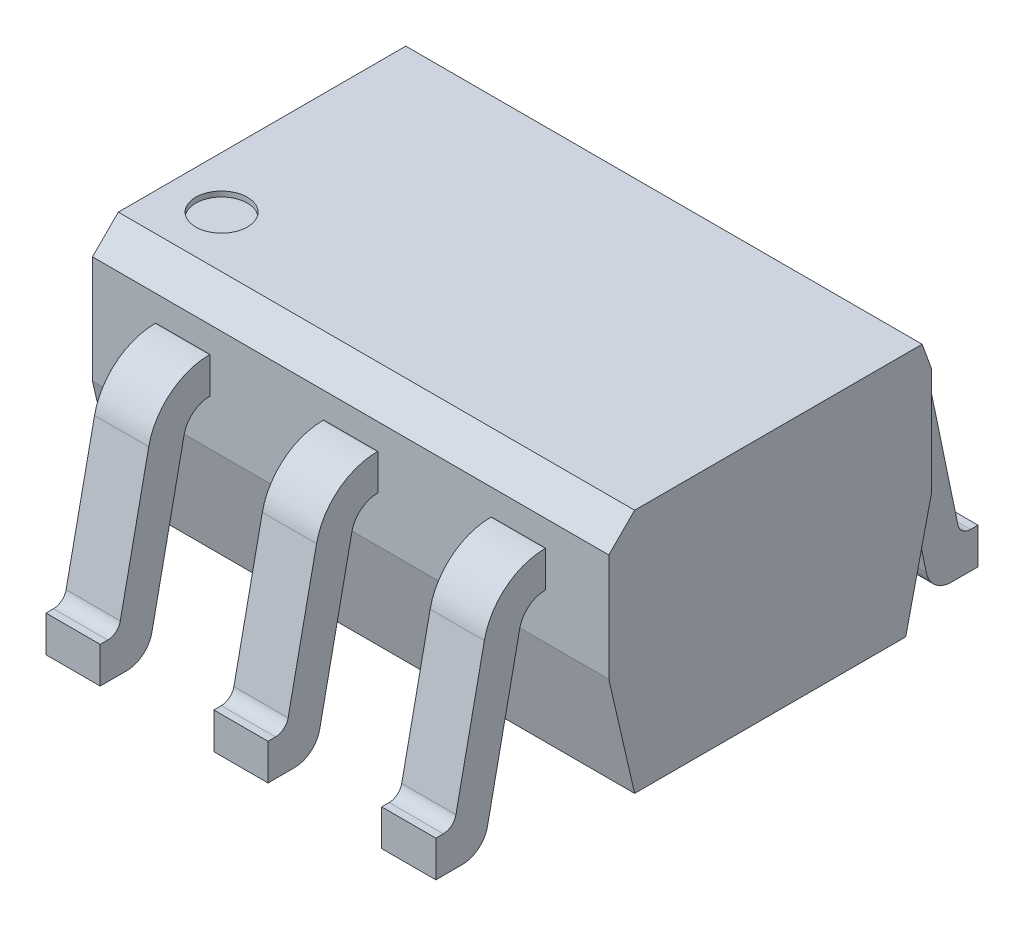
from build123d import *

# Parameters (mm, degrees)
SKETCH_2_W                     = 2
SKETCH_2_H                     = 1.25
EXTRUDE_1_DEPTH                = 0.95
EXTRUDE_2_DEPTH                = 0.105
FILLET_1_R                     = 0.05
CHAMFER_1_SIZE                 = 0.1
PATTERN_LINEAR_2_COUNT         = 3
PATTERN_LINEAR_2_PITCH         = 0.65
FILLET_1_OF_PATTERN_LINEAR_2_R = 0.05
MIRROR_START                   = -0.755
MIRROR_1_DEPTH                 = 0.21
MIRROR_START_2                 = -0.105
MIRROR_1_2_DEPTH               = 0.21
MIRROR_START_3                 = 0.545
MIRROR_1_3_DEPTH               = 0.21
CHAMFER_2_SIZE                 = 0.1
CHAMFER_2_SIZE2                = 0.036397023
CHAMFER_3_SIZE                 = 0.1
CHAMFER_3_SIZE2                = 0.433147587
CHAMFER_4_SIZE                 = 0.1
CHAMFER_4_SIZE2                = 0.433147587
SKETCH_7_R                     = 0.1
CUT_EXTRUDE_2_DEPTH            = 0.02


# Read off the part's stored shape, not the designer's step: Зеркальное отражение1
with BuildPart() as part:
    # Эскиз2 → Бобышка-Вытянуть1 (new body)
    with BuildSketch(Plane(origin=(0, 0.15, 0), x_dir=(-1, 0, 0), z_dir=(0, 1, 0))):
        Rectangle(SKETCH_2_W, SKETCH_2_H)
    extrude(amount=EXTRUDE_1_DEPTH)

    # Эскиз4 → Вытянуть-Тонкостенный2 (add, symmetric)
    with BuildSketch(Plane(origin=(0.65, 0, 0), x_dir=(0, 0, -1), z_dir=(1, 0, 0))):
        with BuildLine():
            Line((-0.625, 0.76), (-0.627096927, 0.76))
            ThreePointArc((-0.627096927, 0.76), (-0.690195555, 0.737579399), (-0.725, 0.680371263))
            Line((-0.725, 0.680371263), (-0.85, 0.079628737))
            ThreePointArc((-0.85, 0.079628737), (-0.884804445, 0.022420601), (-0.947903073, 0))
            Line((-0.947903073, 0), (-1.05, 0))
            Line((-1.05, 0), (-1.05, 0.14))
            Line((-1.05, 0.14), (-0.980436776, 0.14))
            Line((-0.980436776, 0.14), (-0.862064302, 0.708891032))
            ThreePointArc((-0.862064302, 0.708891032), (-0.778533634, 0.846190558), (-0.627096927, 0.9))
            Line((-0.627096927, 0.9), (-0.625, 0.9))
            Line((-0.625, 0.9), (-0.625, 0.76))
        make_face()
    extrude_2 = extrude(amount=EXTRUDE_2_DEPTH, both=True)

    # Скругление1
    fillet_1_edges = [part.edges().sort_by_distance(p)[0] for p in [
        (0.65, 0.14, 0.980436776),
    ]]
    fillet(fillet_1_edges, radius=FILLET_1_R)

    # Фаска1
    chamfer_1_edges = [part.edges().sort_by_distance(p)[0] for p in [
        (0, 1.1, 0.625),
    ]]
    chamfer(chamfer_1_edges, length=CHAMFER_1_SIZE)

    # Линейный массив2: Вытянуть-Тонкостенный2 ×3
    with Locations(*[(-i * PATTERN_LINEAR_2_PITCH, 0, 0) for i in range(1, PATTERN_LINEAR_2_COUNT)]):
        add(extrude_2)

    # Скругление1 of Линейный массив2
    fillet_1_of_pattern_linear_2_edges = [part.edges().sort_by_distance(p)[0] for p in [
        (0, 0.14, 0.980436776),
        (-0.65, 0.14, 0.980436776),
    ]]
    fillet(fillet_1_of_pattern_linear_2_edges, radius=FILLET_1_OF_PATTERN_LINEAR_2_R)

    # Зеркальное отражение1 outline → Зеркальное отражение1 (add)
    with BuildSketch(Plane.YZ.offset(MIRROR_START)):
        with BuildLine():
            Line((0, -1.05), (0.14, -1.05))
            Line((0.14, -1.05), (0.14, -1.021103904))
            ThreePointArc((0.14, -1.021103904), (0.1512103, -0.98955459), (0.179814368, -0.972152368))
            Line((0.179814368, -0.972152368), (0.708891032, -0.862064302))
            ThreePointArc((0.708891032, -0.862064302), (0.846190558, -0.778533634), (0.9, -0.627096927))
            Line((0.9, -0.627096927), (0.9, -0.625))
            Line((0.9, -0.625), (0.76, -0.625))
            Line((0.76, -0.625), (0.76, -0.627096927))
            ThreePointArc((0.76, -0.627096927), (0.737579399, -0.690195555), (0.680371263, -0.725))
            Line((0.680371263, -0.725), (0.079628737, -0.85))
            ThreePointArc((0.079628737, -0.85), (0.022420601, -0.884804445), (0, -0.947903073))
            Line((0, -0.947903073), (0, -1.05))
        make_face()
    extrude(amount=MIRROR_1_DEPTH)

    # Mirror 1 2 outline → Mirror 1 2 (add)
    with BuildSketch(Plane.YZ.offset(MIRROR_START_2)):
        with BuildLine():
            Line((0, -1.05), (0.14, -1.05))
            Line((0.14, -1.05), (0.14, -1.021103904))
            ThreePointArc((0.14, -1.021103904), (0.1512103, -0.98955459), (0.179814368, -0.972152368))
            Line((0.179814368, -0.972152368), (0.708891032, -0.862064302))
            ThreePointArc((0.708891032, -0.862064302), (0.846190558, -0.778533634), (0.9, -0.627096927))
            Line((0.9, -0.627096927), (0.9, -0.625))
            Line((0.9, -0.625), (0.76, -0.625))
            Line((0.76, -0.625), (0.76, -0.627096927))
            ThreePointArc((0.76, -0.627096927), (0.737579399, -0.690195555), (0.680371263, -0.725))
            Line((0.680371263, -0.725), (0.079628737, -0.85))
            ThreePointArc((0.079628737, -0.85), (0.022420601, -0.884804445), (0, -0.947903073))
            Line((0, -0.947903073), (0, -1.05))
        make_face()
    extrude(amount=MIRROR_1_2_DEPTH)

    # Mirror 1 3 outline → Mirror 1 3 (add)
    with BuildSketch(Plane.YZ.offset(MIRROR_START_3)):
        with BuildLine():
            Line((0, -1.05), (0.14, -1.05))
            Line((0.14, -1.05), (0.14, -1.021103904))
            ThreePointArc((0.14, -1.021103904), (0.1512103, -0.98955459), (0.179814368, -0.972152368))
            Line((0.179814368, -0.972152368), (0.708891032, -0.862064302))
            ThreePointArc((0.708891032, -0.862064302), (0.846190558, -0.778533634), (0.9, -0.627096927))
            Line((0.9, -0.627096927), (0.9, -0.625))
            Line((0.9, -0.625), (0.76, -0.625))
            Line((0.76, -0.625), (0.76, -0.627096927))
            ThreePointArc((0.76, -0.627096927), (0.737579399, -0.690195555), (0.680371263, -0.725))
            Line((0.680371263, -0.725), (0.079628737, -0.85))
            ThreePointArc((0.079628737, -0.85), (0.022420601, -0.884804445), (0, -0.947903073))
            Line((0, -0.947903073), (0, -1.05))
        make_face()
    extrude(amount=MIRROR_1_3_DEPTH)

    # Фаска2
    chamfer_2_edges = [part.edges().sort_by_distance(p)[0] for p in [
        (0, 1.1, -0.625),
    ]]
    chamfer_2_side = [part.faces().sort_by_distance(p)[0] for p in [
        (0, 0.615020422, -0.625),
    ]]
    chamfer(chamfer_2_edges, length=CHAMFER_2_SIZE, length2=CHAMFER_2_SIZE2, reference=chamfer_2_side[0])

    # Фаска3
    chamfer_3_edges = [part.edges().sort_by_distance(p)[0] for p in [
        (0, 0.15, -0.625),
    ]]
    chamfer_3_side = [part.faces().sort_by_distance(p)[0] for p in [
        (0, 0.15, 0),
    ]]
    chamfer(chamfer_3_edges, length=CHAMFER_3_SIZE, length2=CHAMFER_3_SIZE2, reference=chamfer_3_side[0])

    # Фаска4
    chamfer_4_edges = [part.edges().sort_by_distance(p)[0] for p in [
        (0, 0.15, 0.625),
    ]]
    chamfer_4_side = [part.faces().sort_by_distance(p)[0] for p in [
        (0, 0.15, 0.05),
    ]]
    chamfer(chamfer_4_edges, length=CHAMFER_4_SIZE, length2=CHAMFER_4_SIZE2, reference=chamfer_4_side[0])

    # Эскиз7 → Вырез-Вытянуть2 (cut)
    with BuildSketch(Plane(origin=(0, 1.1, 0), x_dir=(1, 0, 0), z_dir=(0, 1, 0))):
        with Locations(Location((-0.8, -0.325, 0), (0, 0, 270))):
            Circle(SKETCH_7_R)
    extrude(amount=-CUT_EXTRUDE_2_DEPTH, mode=Mode.SUBTRACT)


solid = part.part
